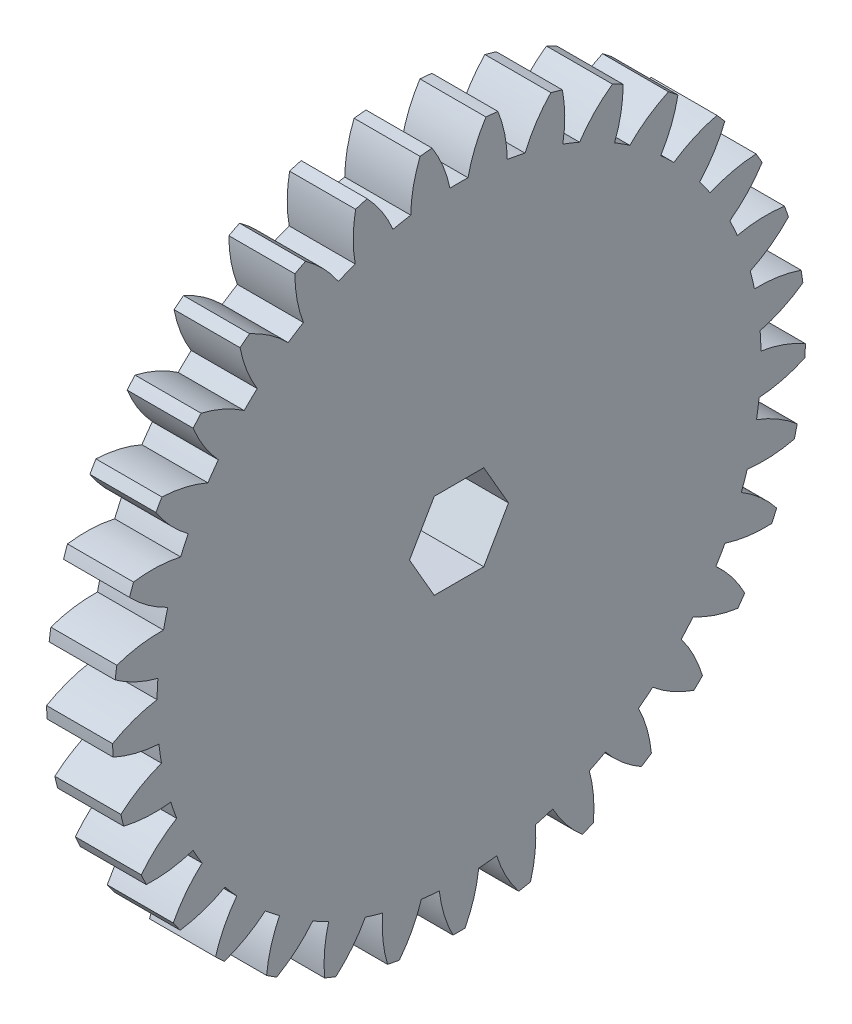
from build123d import *

# Parameters (mm, degrees)
BASPROSKE_W         = 5
BASPROSKE_H         = 26.25
TOOTHCUT_DEPTH      = 38.458310159
TEETHCUTS_COUNT     = 33
TEETHCUTS_ANGLE     = 349.090909091
BORE_DEPTH          = 50.0000508
BOSS_EXTRUDE1_DEPTH = 6


with BuildPart() as part:
    # BasProSke → Base-Revolve (revolve)
    with BuildSketch(Plane(origin=(0, 0, 0), x_dir=(1, 0, 0), z_dir=(0, 1, 0))):
        with Locations((2.5, 13.125)):
            Rectangle(BASPROSKE_W, BASPROSKE_H)
    revolve(axis=Axis((-10, 0, 0), (1, 0, 0)))

    # TooCutSke → ToothCut (cut, through all)
    with BuildSketch(Plane(origin=(0, 0, 0), x_dir=(0, 0, -1), z_dir=(1, 0, 0))):
        with BuildLine():
            ThreePointArc((0.683690741, 22.863780155), (0, 22.874), (-0.683690741, 22.863780155))
            ThreePointArc((-0.683690741, 22.863780155), (-1.217783987, 24.592276227), (-2.057504394, 26.194719331))
            ThreePointArc((-2.057504394, 26.194719331), (0, 26.2754), (2.057504394, 26.194719331))
            ThreePointArc((2.057504394, 26.194719331), (1.217783987, 24.592276227), (0.683690741, 22.863780155))
        make_face()
    toothcut = extrude(amount=TOOTHCUT_DEPTH, mode=Mode.SUBTRACT)

    # TeethCuts: ToothCut ×33 about axis
    teethcuts_axis = Axis((-10, 0, 0), (1, 0, 0))
    for i in range(1, TEETHCUTS_COUNT):
        add(toothcut.rotate(teethcuts_axis, i * TEETHCUTS_ANGLE / (TEETHCUTS_COUNT - 1)), mode=Mode.SUBTRACT)

    # BorSke → Bore (cut, symmetric)
    with BuildSketch(Plane(origin=(0, 0, 0), x_dir=(0, 0, -1), z_dir=(1, 0, 0))):
        Polygon((-3.75, 0), (-1.875, -3.247595264), (1.875, -3.247595264), (3.75, 0), (1.875, 3.247595264), (-1.875, 3.247595264), align=None)
    extrude(amount=BORE_DEPTH, both=True, mode=Mode.SUBTRACT)

    # Sketch1 → Boss-Extrude1 (add)
    with BuildSketch(Plane.ZY):
        with BuildLine():
            ThreePointArc((0.186825137, -8.998060686), (1.087459558, -7.388027892), (0.875696025, -5.555405682))
            ThreePointArc((0.875696025, -5.555405682), (1.73791157, -5.348741832), (2.556932562, -5.009138816))
            ThreePointArc((2.556932562, -5.009138816), (3.462800574, -6.616232809), (5.13778266, -7.389397069))
            ThreePointArc((5.13778266, -7.389397069), (5.290067265, -7.281152932), (5.440072088, -7.169770943))
            ThreePointArc((5.440072088, -7.169770943), (5.222347109, -5.337847421), (3.973838504, -3.979696391))
            ThreePointArc((3.973838504, -3.979696391), (4.549911569, -3.305704242), (5.012899826, -2.549551171))
            ThreePointArc((5.012899826, -2.549551171), (6.690388591, -3.317261664), (8.499932112, -2.958234922))
            ThreePointArc((8.499932112, -2.958234922), (8.559508639, -2.781152931), (8.615396399, -2.602872386))
            ThreePointArc((8.615396399, -2.602872386), (7.362475561, -1.248790656), (5.554109736, -0.883878337))
            ThreePointArc((5.554109736, -0.883878337), (5.623999991, 1.7e-08), (5.554109736, 0.883878372))
            ThreePointArc((5.554109736, 0.883878372), (7.36247556, 1.248790692), (8.615396397, 2.602872424))
            ThreePointArc((8.615396397, 2.602872424), (8.559508637, 2.781152968), (8.49993211, 2.958234959))
            ThreePointArc((8.49993211, 2.958234959), (6.690388588, 3.3172617), (5.012899824, 2.549551205))
            ThreePointArc((5.012899824, 2.549551205), (4.549911566, 3.305704276), (3.9738385, 3.979696424))
            ThreePointArc((3.9738385, 3.979696424), (5.222347104, 5.337847455), (5.440072081, 7.169770978))
            ThreePointArc((5.440072081, 7.169770978), (5.290067259, 7.281152967), (5.137782653, 7.389397103))
            ThreePointArc((5.137782653, 7.389397103), (3.462800568, 6.616232842), (2.556932557, 5.009138848))
            ThreePointArc((2.556932557, 5.009138848), (1.737911565, 5.348741863), (0.87569602, 5.555405712))
            ThreePointArc((0.87569602, 5.555405712), (1.087459551, 7.388027922), (0.186825128, 8.998060715))
            ThreePointArc((0.186825128, 8.998060715), (-1.3e-08, 9.000000015), (-0.186825154, 8.998060715))
            ThreePointArc((-0.186825154, 8.998060715), (-1.087459575, 7.388027921), (-0.875696042, 5.555405712))
            ThreePointArc((-0.875696042, 5.555405712), (-1.737911587, 5.348741861), (-2.556932579, 5.009138846))
            ThreePointArc((-2.556932579, 5.009138846), (-3.462800592, 6.616232839), (-5.137782677, 7.389397098))
            ThreePointArc((-5.137782677, 7.389397098), (-5.290067283, 7.281152962), (-5.440072105, 7.169770972))
            ThreePointArc((-5.440072105, 7.169770972), (-5.222347126, 5.33784745), (-3.973838521, 3.97969642))
            ThreePointArc((-3.973838521, 3.97969642), (-4.549911586, 3.305704271), (-5.012899843, 2.5495512))
            ThreePointArc((-5.012899843, 2.5495512), (-6.690388608, 3.317261694), (-8.499932129, 2.958234951))
            ThreePointArc((-8.499932129, 2.958234951), (-8.559508657, 2.78115296), (-8.615396416, 2.602872416))
            ThreePointArc((-8.615396416, 2.602872416), (-7.362475579, 1.248790686), (-5.554109754, 0.883878367))
            ThreePointArc((-5.554109754, 0.883878367), (-5.624000009, 1.2e-08), (-5.554109753, -0.883878343))
            ThreePointArc((-5.554109753, -0.883878343), (-7.362475577, -1.248790663), (-8.615396414, -2.602872394))
            ThreePointArc((-8.615396414, -2.602872394), (-8.559508654, -2.781152939), (-8.499932127, -2.95823493))
            ThreePointArc((-8.499932127, -2.95823493), (-6.690388605, -3.317261671), (-5.012899841, -2.549551175))
            ThreePointArc((-5.012899841, -2.549551175), (-4.549911583, -3.305704246), (-3.973838517, -3.979696394))
            ThreePointArc((-3.973838517, -3.979696394), (-5.222347121, -5.337847426), (-5.440072098, -7.169770948))
            ThreePointArc((-5.440072098, -7.169770948), (-5.290067276, -7.281152937), (-5.13778267, -7.389397073))
            ThreePointArc((-5.13778267, -7.389397073), (-3.462800585, -6.616232813), (-2.556932575, -5.009138819))
            ThreePointArc((-2.556932575, -5.009138819), (-1.737911582, -5.348741834), (-0.875696037, -5.555405683))
            ThreePointArc((-0.875696037, -5.555405683), (-1.087459568, -7.388027893), (-0.186825145, -8.998060686))
            ThreePointArc((-0.186825145, -8.998060686), (-4e-09, -8.999999985), (0.186825137, -8.998060686))
        make_face()
        Polygon((3.75, 0), (1.875, 3.247595264), (-1.875, 3.247595264), (-3.75, 0), (-1.875, -3.247595264), (1.875, -3.247595264), align=None, mode=Mode.SUBTRACT)
    extrude(amount=BOSS_EXTRUDE1_DEPTH)


solid = part.part
